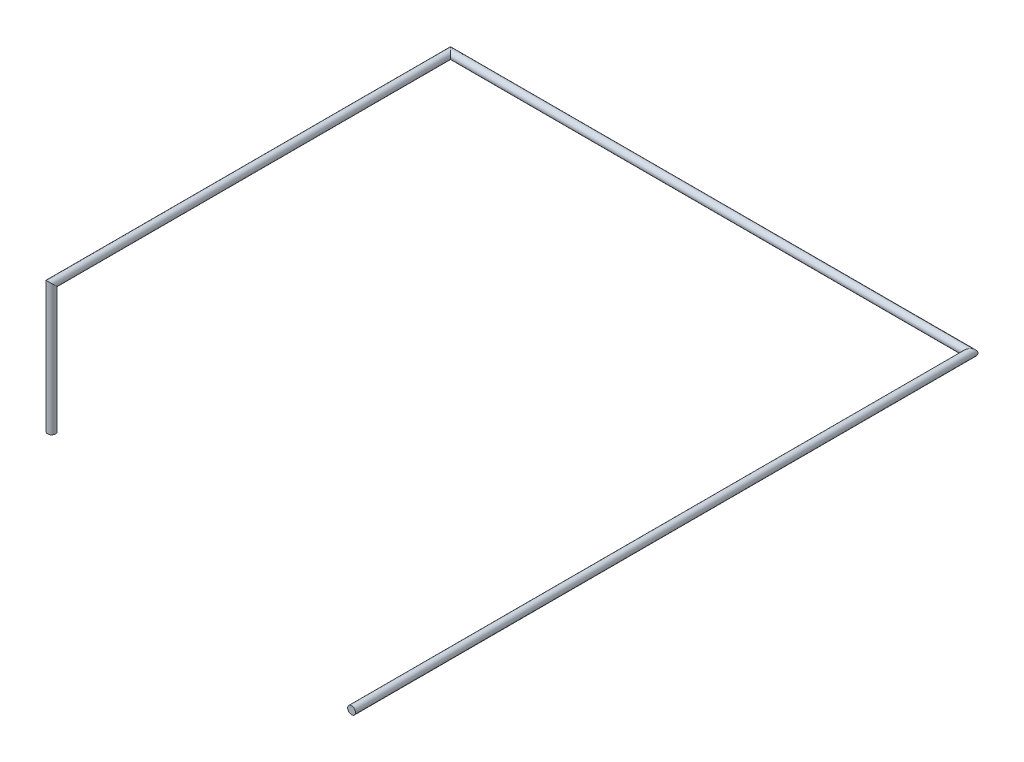
from build123d import *

# Parameters (mm, degrees)
CROQUIS1_R              = 12.7
SALIENTE_EXTRUIR1_DEPTH = 10
CROQUIS2_R              = 12.7
CROQUIS3_W              = 1.633119478
CROQUIS3_H              = 0.485299122
SALIENTE_EXTRUIR2_DEPTH = 1


with BuildPart() as part:
    # Croquis1 → Saliente-Extruir1 (new body)
    with BuildSketch(Plane(origin=(0, 0, 0), x_dir=(1, 0, 0), z_dir=(0, 1, 0))):
        Circle(CROQUIS1_R)
    extrude(amount=SALIENTE_EXTRUIR1_DEPTH)

    # Barrer1: sweep along a curve in space
    with BuildLine() as barrer1_path:
        Line((0, 10, 0), (0, 415, 0))
        Line((0, 415, 0), (0, 415, -1290))
        Line((0, 415, -1290), (1680, 415, -1290))
        Line((1680, 415, -1290), (1680, 415, 710))
    # Croquis2 → Barrer1 (sweep)
    with BuildSketch(Plane(origin=(0, 10, 0), x_dir=(1, 0, 0), z_dir=(0, 1, 0))):
        Circle(CROQUIS2_R)
    sweep(path=barrer1_path.line, transition=Transition.RIGHT)

    # Croquis3 → Saliente-Extruir2 (add)
    with BuildSketch(Plane.XZ):
        with Locations((0, 12.7)):
            Rectangle(CROQUIS3_W, CROQUIS3_H)
    extrude(amount=-SALIENTE_EXTRUIR2_DEPTH)


solid = part.part
